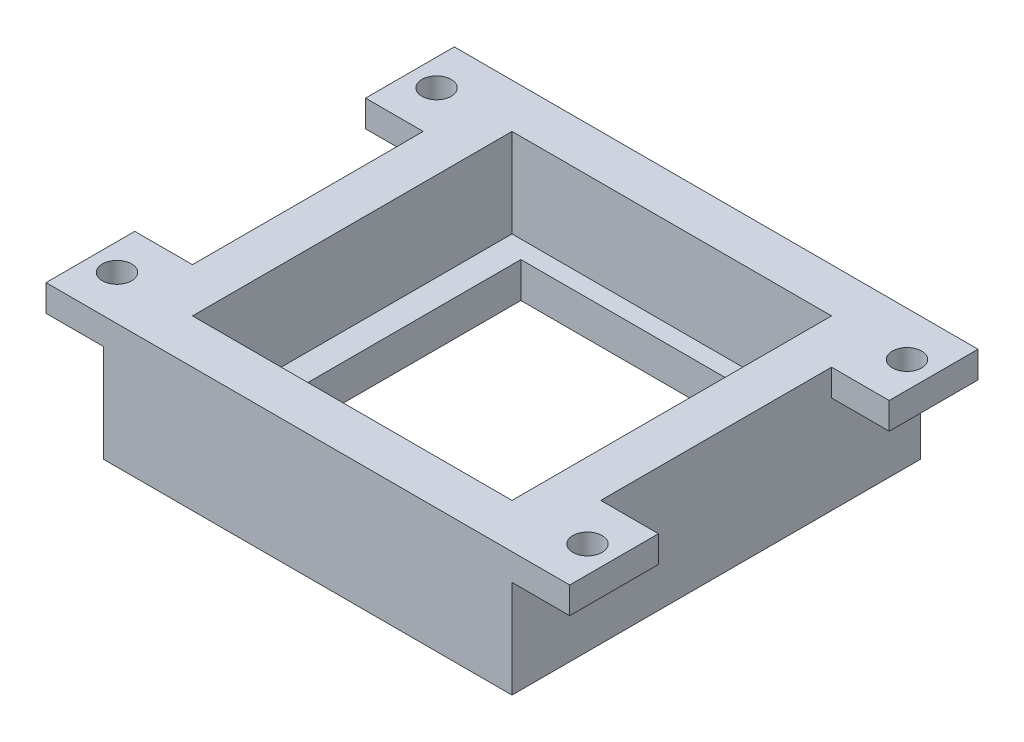
from build123d import *
from build123d.topology import SkipClean

# Parameters (mm, degrees)
SKETCH_1_W                 = 21
SKETCH_1_H                 = 20
EXTRUDE_1_DEPTH            = 4
SKETCH_2_R                 = 1.65
CUT_EXTRUDE_1_DEPTH        = 4
FILLET_1_R                 = 5
SKETCH_4_W                 = 44
SKETCH_4_H                 = 3
EXTRUDE_2_DEPTH            = 7
EXTRUDE_3_DEPTH            = 110
SKETCH_7_R                 = 1.5
CUT_EXTRUDE_3_DEPTH        = 93
CUT_EXTRUDE_4_DEPTH        = 93
SKETCH_18_W                = 8.046739473
SKETCH_18_H                = 3.477045647
CUT_EXTRUDE_5_DEPTH        = 10
EXTRUDE_START              = 1
SKETCH_21_R                = 1.5
EXTRUDE_4_DEPTH            = 1
SKETCH_27_W                = 38
SKETCH_27_H                = 4
EXTRUDE_9_DEPTH            = 1
FILLET_4_R                 = 0.5
EXTRUDE_START_2            = -4
SKETCH_28_R                = 1.5
EXTRUDE_10_DEPTH           = 4
SKETCH_30_W                = 6
SKETCH_30_H                = 110.5
EXTRUDE_11_DEPTH           = 4
SKETCH_31_W                = 50
SKETCH_31_H                = 4
CUT_EXTRUDE_6_DEPTH        = 5
SKETCH_32_W                = 30
SKETCH_32_H                = 31
CUT_EXTRUDE_7_DEPTH        = 15
SKETCH_33_W                = 23.953260528
SKETCH_33_H                = 6
EXTRUDE_12_DEPTH           = 4
SKETCH_34_W                = 46
SKETCH_34_H                = 46
SKETCH_34_W_2              = 36
SKETCH_34_H_2              = 36
EXTRUDE_1_2_DEPTH          = 10
SKETCH_36_W                = 6
SKETCH_36_H                = 6
EXTRUDE_13_DEPTH           = 4
SKETCH_37_R                = 1.7
CUT_EXTRUDE_8_DEPTH        = 10
FILLET_6_R                 = 1
SKETCH_38_W                = 10
SKETCH_38_H                = 5
CUT_EXTRUDE_9_DEPTH        = 10
SKETCH_39_W                = 7.314348503
SKETCH_39_H                = 1
SKETCH_39_W_2              = 6.638912025
EXTRUDE_14_DEPTH           = 4
SKETCH_40_W                = 10
SKETCH_40_H                = 1
SKETCH_40_H_2              = 4
EXTRUDE_15_DEPTH           = 14
SPLIT_START                = -29.5
SPLIT_BODIES_2_DEPTH       = 46
SPLIT_BODIES_2_2_DEPTH     = 5
SPLIT_START_2              = 11.5
SPLIT_BODIES_2_3_DEPTH     = 5
SPLIT_START_3              = -24.5
SPLIT_BODIES_2_4_OUTLINE_W = 4
SPLIT_BODIES_2_4_OUTLINE_H = 31
SPLIT_BODIES_2_4_DEPTH     = 3
SPLIT_START_4              = 8.5
SPLIT_BODIES_2_5_OUTLINE_W = 4
SPLIT_BODIES_2_5_OUTLINE_H = 31
SPLIT_BODIES_2_5_DEPTH     = 3
SPLIT_START_5              = -37.5
SPLIT_BODIES_2_6_OUTLINE_W = 14
SPLIT_BODIES_2_6_OUTLINE_H = 46
SPLIT_BODIES_2_6_DEPTH     = 54
SPLIT_START_6              = 10
SPLIT_BODIES_2_7_OUTLINE_R = 1.7
SPLIT_BODIES_2_7_DEPTH     = 4
SKETCH_43_W                = 5
SKETCH_43_H                = 5
SKETCH_43_W_2              = 36
EXTRUDE_16_DEPTH           = 3
SKETCH_44_W                = 6.5
SKETCH_44_H                = 10
SKETCH_44_R                = 1.65
EXTRUDE_17_DEPTH           = 3
SPLIT_START_7              = 24
SPLIT_BODIES_4_OUTLINE_W   = 59
SPLIT_BODIES_4_OUTLINE_H   = 10
SPLIT_BODIES_4_OUTLINE_R   = 1.65
SPLIT_BODIES_4_DEPTH       = 3
SPLIT_BODIES_4_2_OUTLINE_W = 59
SPLIT_BODIES_4_2_OUTLINE_H = 10
SPLIT_BODIES_4_2_OUTLINE_R = 1.65
SPLIT_BODIES_4_2_DEPTH     = 3
SPLIT_BODIES_4_3_OUTLINE_W = 59
SPLIT_BODIES_4_3_OUTLINE_H = 10
SPLIT_BODIES_4_3_OUTLINE_R = 1.65
SPLIT_BODIES_4_3_DEPTH     = 3


# Read off the part's stored shape, not the designer's step: 分割1, 分割2, 分割4
with BuildPart() as part:
    # 草图1 → Extrude 1 (new body)
    with BuildSketch(Plane.XY):
        Rectangle(SKETCH_1_W, SKETCH_1_H)
    extrude(amount=EXTRUDE_1_DEPTH)

    # 草图2 → 切除-拉伸1 (cut)
    with BuildSketch(Plane.XY.offset(4)):
        with Locations((-5, 4)):
            Circle(SKETCH_2_R)
        with Locations((5, 4)):
            Circle(SKETCH_2_R)
        with Locations((-5, -4)):
            Circle(SKETCH_2_R)
        with Locations((5, -4)):
            Circle(SKETCH_2_R)
    extrude(amount=-CUT_EXTRUDE_1_DEPTH, mode=Mode.SUBTRACT)

    # 圆角1
    fillet_1_edges = [part.edges().sort_by_distance(p)[0] for p in [
        (10.5, -10, 2),
        (-10.5, -10, 2),
    ]]
    fillet(fillet_1_edges, radius=FILLET_1_R)

    # 草图4 → 凸台-拉伸2 (add)
    with BuildSketch(Plane.XY.offset(4)):
        with Locations((-6.5, 11.5)):
            Rectangle(SKETCH_4_W, SKETCH_4_H)
    extrude(amount=-EXTRUDE_2_DEPTH)

    # 草图5 → 凸台-拉伸3 (add)
    with BuildSketch(Plane.XY.offset(4)):
        Polygon((-6.5, 13), (12.5, 13), (12.5, 10), (-25.5, 10), (-25.5, 13), align=None)
    extrude(amount=EXTRUDE_3_DEPTH)

    # 草图7 → 切除-拉伸3 (cut)
    with BuildSketch(Plane(origin=(0, 13, 0), x_dir=(1, 0, 0), z_dir=(0, 1, 0))):
        with Locations(Location((8.232, -104.79, 0), (0, 0, 270))):
            Circle(SKETCH_7_R)
        with Locations(Location((-21.232, -104.79, 0), (0, 0, 270))):
            Circle(SKETCH_7_R)
        with BuildLine():
            Line((5.476630264, -60.258900788), (5.476630264, -85.258900788))
            Line((5.476630264, -85.258900788), (5.476630264, -111))
            Line((5.476630264, -111), (-6.5, -111))
            Line((-6.5, -111), (-18.476630264, -111))
            Line((-18.476630264, -111), (-18.476630264, -85.258900788))
            Line((-18.476630264, -85.258900788), (-18.476630264, -60.258900788))
            ThreePointArc((-18.476630264, -60.258900788), (-6.5, -48.282270524), (5.476630264, -60.258900788))
        make_face()
    extrude(amount=-CUT_EXTRUDE_3_DEPTH, mode=Mode.SUBTRACT)

    # 草图12 → 切除-拉伸4 (cut)
    with BuildSketch(Plane(origin=(0, 13, 0), x_dir=(1, 0, 0), z_dir=(0, 1, 0))):
        with BuildLine():
            Line((-16.5, -11.5), (3.5, -11.5))
            ThreePointArc((3.5, -11.5), (6, -14), (3.5, -16.5))
            Line((3.5, -16.5), (-16.5, -16.5))
            ThreePointArc((-16.5, -16.5), (-19, -14), (-16.5, -11.5))
        make_face()
        with BuildLine():
            Line((-16.5, -24), (3.5, -24))
            ThreePointArc((3.5, -24), (6, -26.5), (3.5, -29))
            Line((3.5, -29), (-16.5, -29))
            ThreePointArc((-16.5, -29), (-19, -26.5), (-16.5, -24))
        make_face()
        with BuildLine():
            Line((-16.5, -34.5), (3.5, -34.5))
            ThreePointArc((3.5, -34.5), (6, -37), (3.5, -39.5))
            Line((3.5, -39.5), (-16.5, -39.5))
            ThreePointArc((-16.5, -39.5), (-19, -37), (-16.5, -34.5))
        make_face()
    extrude(amount=-CUT_EXTRUDE_4_DEPTH, mode=Mode.SUBTRACT)

    # 草图18 → 切除-拉伸5 (cut)
    with BuildSketch(Plane(origin=(0, 13, 0), x_dir=(1, 0, 0), z_dir=(0, 1, 0))):
        with Locations((5.476630263, -99.520878329)):
            Rectangle(SKETCH_18_W, SKETCH_18_H)
        with Locations((-18.476630263, -99.520878329)):
            Rectangle(SKETCH_18_W, SKETCH_18_H)
    extrude(amount=-CUT_EXTRUDE_5_DEPTH, mode=Mode.SUBTRACT)

    # 草图21 → 凸台-拉伸4 (add)
    with BuildSketch(Plane(origin=(0, 13, 0), x_dir=(1, 0, 0), z_dir=(0, 1, 0)).offset(EXTRUDE_START)):
        Polygon((12.5, -4), (15.5, -4), (15.5, 3), (-28.5, 3), (-28.5, -4), (-25.5, -4), (-25.5, -114), (12.5, -114), align=None)
        with Locations(Location((8.232, -104.79, 0), (0, 0, 270))):
            Circle(SKETCH_21_R, mode=Mode.SUBTRACT)
        with Locations(Location((-21.232, -104.79, 0), (0, 0, 270))):
            Circle(SKETCH_21_R, mode=Mode.SUBTRACT)
        with BuildLine():
            Line((9.5, -97.782355505), (5.476630264, -97.782355505))
            Line((5.476630264, -97.782355505), (5.476630264, -60.258900788))
            ThreePointArc((5.476630264, -60.258900788), (-6.5, -48.282270524), (-18.476630264, -60.258900788))
            Line((-18.476630264, -60.258900788), (-18.476630264, -97.782355505))
            Line((-18.476630264, -97.782355505), (-22.5, -97.782355505))
            Line((-22.5, -97.782355505), (-22.5, -101.259401152))
            Line((-22.5, -101.259401152), (-18.476630264, -101.259401152))
            Line((-18.476630264, -101.259401152), (-18.476630264, -111))
            Line((-18.476630264, -111), (5.476630264, -111))
            Line((5.476630264, -111), (5.476630264, -101.259401152))
            Line((5.476630264, -101.259401152), (9.5, -101.259401152))
            Line((9.5, -101.259401152), (9.5, -97.782355505))
        make_face(mode=Mode.SUBTRACT)
        with BuildLine():
            Line((-16.5, -39.5), (3.5, -39.5))
            ThreePointArc((3.5, -39.5), (6, -37), (3.5, -34.5))
            Line((3.5, -34.5), (-16.5, -34.5))
            ThreePointArc((-16.5, -34.5), (-19, -37), (-16.5, -39.5))
        make_face(mode=Mode.SUBTRACT)
        with BuildLine():
            Line((-16.5, -29), (3.5, -29))
            ThreePointArc((3.5, -29), (6, -26.5), (3.5, -24))
            Line((3.5, -24), (-16.5, -24))
            ThreePointArc((-16.5, -24), (-19, -26.5), (-16.5, -29))
        make_face(mode=Mode.SUBTRACT)
        with BuildLine():
            Line((-16.5, -16.5), (3.5, -16.5))
            ThreePointArc((3.5, -16.5), (6, -14), (3.5, -11.5))
            Line((3.5, -11.5), (-16.5, -11.5))
            ThreePointArc((-16.5, -11.5), (-19, -14), (-16.5, -16.5))
        make_face(mode=Mode.SUBTRACT)
    extrude(amount=-EXTRUDE_4_DEPTH)

    # 草图27 → 凸台-拉伸9 (add)
    with BuildSketch(Plane.XY.offset(114)):
        with Locations((-6.5, 12)):
            Rectangle(SKETCH_27_W, SKETCH_27_H)
    extrude(amount=EXTRUDE_9_DEPTH)

    # 圆角4
    fillet_4_edges = [part.edges().sort_by_distance(p)[0] for p in [
        (-25.5, 12, 115),
        (12.5, 12, 115),
    ]]
    fillet(fillet_4_edges, radius=FILLET_4_R)

    # 草图28 → 凸台-拉伸10 (add)
    with BuildSketch(Plane.XZ.offset(-10).offset(EXTRUDE_START_2)):
        with Locations((-21.232, 104.79)):
            Circle(SKETCH_28_R)
        with Locations((8.232, 104.79)):
            Circle(SKETCH_28_R)
        Polygon((-18.476630264, 111), (5.476630264, 111), (5.476630264, 101.259401152), (9.5, 101.259401152), (9.5, 97.782355505), (5.476630264, 97.782355505), (5.476630264, 75), (-18.476630264, 75), (-18.476630264, 97.782355505), (-22.5, 97.782355505), (-22.5, 101.259401152), (-18.476630264, 101.259401152), align=None)
    extrude(amount=EXTRUDE_10_DEPTH)

    # 草图30 → 凸台-拉伸11 (add)
    with BuildSketch(Plane(origin=(0, 14, 0), x_dir=(1, 0, 0), z_dir=(0, 1, 0))):
        with Locations((-28.5, -59.25)):
            Rectangle(SKETCH_30_W, SKETCH_30_H)
        with Locations((15.5, -59.25)):
            Rectangle(SKETCH_30_W, SKETCH_30_H)
    extrude(amount=-EXTRUDE_11_DEPTH)

    # 草图31 → 切除-拉伸6 (cut)
    with BuildSketch(Plane.XY.offset(115)):
        with Locations((-6.5, 12)):
            Rectangle(SKETCH_31_W, SKETCH_31_H)
    extrude(amount=-CUT_EXTRUDE_6_DEPTH, mode=Mode.SUBTRACT)

    # 草图32 → 切除-拉伸7 (cut)
    with BuildSketch(Plane(origin=(0, 14, 0), x_dir=(1, 0, 0), z_dir=(0, 1, 0))):
        with Locations((-6.5, -86.5)):
            Rectangle(SKETCH_32_W, SKETCH_32_H)
    extrude(amount=-CUT_EXTRUDE_7_DEPTH, mode=Mode.SUBTRACT)

    # 草图33 → 凸台-拉伸12 (add)
    with BuildSketch(Plane(origin=(0, 14, 0), x_dir=(1, 0, 0), z_dir=(0, 1, 0))):
        with Locations((-6.5, -68)):
            Rectangle(SKETCH_33_W, SKETCH_33_H)
    extrude(amount=-EXTRUDE_12_DEPTH)

    # 草图34 → Extrude 1 2 (add)
    with BuildSketch(Plane(origin=(0, 14, 0), x_dir=(1, 0, 0), z_dir=(0, 1, 0))):
        with Locations((-6.5, -87)):
            Rectangle(SKETCH_34_W, SKETCH_34_H)
        with Locations((-6.5, -87)):
            Rectangle(SKETCH_34_W_2, SKETCH_34_H_2, mode=Mode.SUBTRACT)
    extrude(amount=EXTRUDE_1_2_DEPTH)

    # 草图36 → 凸台-拉伸13 (add)
    with BuildSketch(Plane(origin=(0, 14, 0), x_dir=(1, 0, 0), z_dir=(0, 1, 0))):
        with Locations((21.5, -76)):
            Rectangle(SKETCH_36_W, SKETCH_36_H)
        with Locations((21.5, -97)):
            Rectangle(SKETCH_36_W, SKETCH_36_H)
        with Locations((-34.5, -97)):
            Rectangle(SKETCH_36_W, SKETCH_36_H)
        with Locations((-34.5, -76)):
            Rectangle(SKETCH_36_W, SKETCH_36_H)
    extrude(amount=-EXTRUDE_13_DEPTH)

    # 草图37 → 切除-拉伸8 (cut)
    with BuildSketch(Plane(origin=(0, 14, 0), x_dir=(1, 0, 0), z_dir=(0, 1, 0))):
        with Locations(Location((21.5, -76, 0), (0, 0, 270))):
            Circle(SKETCH_37_R)
        with Locations(Location((21.5, -97, 0), (0, 0, 270))):
            Circle(SKETCH_37_R)
        with Locations(Location((-34.5, -76, 0), (0, 0, 270))):
            Circle(SKETCH_37_R)
        with Locations(Location((-34.5, -97, 0), (0, 0, 270))):
            Circle(SKETCH_37_R)
    extrude(amount=-CUT_EXTRUDE_8_DEPTH, mode=Mode.SUBTRACT)

    # 圆角6
    fillet_6_edges = [part.edges().sort_by_distance(p)[0] for p in [
        (24.5, 12, 79),
        (24.5, 12, 73),
        (24.5, 12, 100),
        (24.5, 12, 94),
        (-37.5, 12, 100),
        (-37.5, 12, 94),
        (-37.5, 12, 79),
        (-37.5, 12, 73),
    ]]
    fillet(fillet_6_edges, radius=FILLET_6_R)

    # 草图38 → 切除-拉伸9 (cut)
    with BuildSketch(Plane(origin=(0, 24, 0), x_dir=(1, 0, 0), z_dir=(0, 1, 0))):
        with Locations((-6.162281761, -66.5)):
            Rectangle(SKETCH_38_W, SKETCH_38_H)
    extrude(amount=-CUT_EXTRUDE_9_DEPTH, mode=Mode.SUBTRACT)


with BuildPart() as body_2:
    # Split Bodies 1: the piece on the far side of the plane
    add(part.part)
    split(bisect_by=Plane.XY.offset(64), keep=Keep.BOTTOM)


with BuildPart() as part_1:
    add(part.part)

    # Split Bodies 1
    split(bisect_by=Plane.XY.offset(64), keep=Keep.TOP)

    # 草图39 → 凸台-拉伸14 (add)
    with BuildSketch(Plane.XZ.offset(-14)):
        with Locations((-14.819456013, 64.5)):
            Rectangle(SKETCH_39_W, SKETCH_39_H)
        with Locations((2.157174252, 64.5)):
            Rectangle(SKETCH_39_W_2, SKETCH_39_H)
    extrude(amount=EXTRUDE_14_DEPTH)

    # 草图40 → 凸台-拉伸15 (add)
    with BuildSketch(Plane.XZ.offset(-10)):
        with Locations((-6.162281761, 64.5)):
            Rectangle(SKETCH_40_W, SKETCH_40_H)
        with Locations((-6.162281761, 67)):
            Rectangle(SKETCH_40_W, SKETCH_40_H_2)
    extrude(amount=-EXTRUDE_15_DEPTH)

    # Split Bodies 2 6 outline → Split Bodies 2 6 (cut)
    with BuildSketch(Plane.YZ.offset(SPLIT_START_5)):
        with Locations((17, 87)):
            Rectangle(SPLIT_BODIES_2_6_OUTLINE_W, SPLIT_BODIES_2_6_OUTLINE_H)
    extrude(amount=SPLIT_BODIES_2_6_DEPTH, mode=Mode.SUBTRACT)


with BuildPart() as body_2_2:
    # Split Bodies 2 outline → Split Bodies 2 (new body)
    with BuildSketch(Plane.YZ.offset(SPLIT_START)):
        Polygon((24, 69), (14, 69), (14, 71), (10, 71), (10, 64), (24, 64), align=None)
        Polygon((10, 102), (14, 102), (14, 105), (24, 105), (24, 110), (10, 110), align=None)
    extrude(amount=SPLIT_BODIES_2_DEPTH)

    # Split Bodies 2 2 outline → Split Bodies 2 2 (add)
    with BuildSketch(Plane.YZ.offset(SPLIT_START)):
        Polygon((14, 71), (14, 69), (24, 69), (24, 105), (14, 105), (14, 102), (10, 102), (10, 71), align=None)
    extrude(amount=SPLIT_BODIES_2_2_DEPTH)

    # Split Bodies 2 3 outline → Split Bodies 2 3 (add)
    with BuildSketch(Plane.YZ.offset(SPLIT_START_2)):
        Polygon((14, 71), (14, 69), (24, 69), (24, 105), (14, 105), (14, 102), (10, 102), (10, 71), align=None)
    extrude(amount=SPLIT_BODIES_2_3_DEPTH)

    # Split Bodies 2 4 outline → Split Bodies 2 4 (add)
    with BuildSketch(Plane.YZ.offset(SPLIT_START_3)):
        with Locations((12, 86.5)):
            Rectangle(SPLIT_BODIES_2_4_OUTLINE_W, SPLIT_BODIES_2_4_OUTLINE_H)
    extrude(amount=SPLIT_BODIES_2_4_DEPTH)

    # Split Bodies 2 5 outline → Split Bodies 2 5 (add)
    with BuildSketch(Plane.YZ.offset(SPLIT_START_4)):
        with Locations((12, 86.5)):
            Rectangle(SPLIT_BODIES_2_5_OUTLINE_W, SPLIT_BODIES_2_5_OUTLINE_H)
    extrude(amount=SPLIT_BODIES_2_5_DEPTH)

    # 草图43 → 凸台-拉伸16 (add)
    with BuildSketch(Plane(origin=(0, 24, 0), x_dir=(1, 0, 0), z_dir=(0, 1, 0))):
        with BuildLine():
            Line((-36, -100), (-36, -105))
            Line((-36, -105), (-34.65, -105))
            ThreePointArc((-34.65, -105), (-33, -103.35), (-31.35, -105))
            Line((-31.35, -105), (-29.5, -105))
            Line((-29.5, -105), (-29.5, -100))
            Line((-29.5, -100), (-36, -100))
        make_face()
        with BuildLine():
            Line((-36, -105), (-36, -110))
            Line((-36, -110), (-29.5, -110))
            Line((-29.5, -110), (-29.5, -105))
            Line((-29.5, -105), (-31.35, -105))
            ThreePointArc((-31.35, -105), (-33, -106.65), (-34.65, -105))
            Line((-34.65, -105), (-36, -105))
        make_face()
        Polygon((-29.5, -105), (-29.5, -110), (16.5, -110), (16.5, -105), (11.5, -105), (-24.5, -105), align=None)
        with Locations((-27, -102.5)):
            Rectangle(SKETCH_43_W, SKETCH_43_H)
        with Locations((-6.5, -102.5)):
            Rectangle(SKETCH_43_W_2, SKETCH_43_H)
        with Locations((14, -102.5)):
            Rectangle(SKETCH_43_W, SKETCH_43_H)
        with BuildLine():
            Line((16.5, -105), (16.5, -110))
            Line((16.5, -110), (23, -110))
            Line((23, -110), (23, -105))
            Line((23, -105), (21.65, -105))
            ThreePointArc((21.65, -105), (20, -106.65), (18.35, -105))
            Line((18.35, -105), (16.5, -105))
        make_face()
        with BuildLine():
            Line((16.5, -100), (16.5, -105))
            Line((16.5, -105), (18.35, -105))
            ThreePointArc((18.35, -105), (20, -103.35), (21.65, -105))
            Line((21.65, -105), (23, -105))
            Line((23, -105), (23, -100))
            Line((23, -100), (16.5, -100))
        make_face()
    extrude_16 = extrude(amount=EXTRUDE_16_DEPTH)

    # 草图44 → 凸台-拉伸17 (add)
    # profile 1 of 2: a face of its own
    with SkipClean():  # the faces are left unmerged after this step: merging them gives an invalid solid
        with BuildSketch(Plane.XZ.offset(-24)):
            with Locations((-32.75, 105)):
                Rectangle(SKETCH_44_W, SKETCH_44_H)
            with Locations(Location((-33, 105, 0), (0, 0, 270))):
                Circle(SKETCH_44_R, mode=Mode.SUBTRACT)
        # profile 2 of 2: a face of its own
        with BuildSketch(Plane.XZ.offset(-24)):
            with Locations((19.75, 105)):
                Rectangle(SKETCH_44_W, SKETCH_44_H)
            with Locations(Location((20, 105, 0), (0, 0, 270))):
                Circle(SKETCH_44_R, mode=Mode.SUBTRACT)
        extrude_17 = extrude(amount=EXTRUDE_17_DEPTH)

    # 镜向2: 凸台-拉伸16, 凸台-拉伸17 across plane
    with SkipClean():  # the faces are left unmerged after this step: merging them gives an invalid solid
        add(extrude_16.mirror(Plane(origin=(0, 0, 87), x_dir=(1, 0, 0), z_dir=(0, 0, -1))))
        add(extrude_17.mirror(Plane(origin=(0, 0, 87), x_dir=(1, 0, 0), z_dir=(0, 0, -1))))
    add(body_2_2.part.scale(1), mode=Mode.REPLACE)  # the faces are merged on a copy

    # Split Bodies 4 outline → Split Bodies 4 (cut)
    # profile 1 of 2: a face of its own
    with BuildSketch(Plane(origin=(0, 0, 0), x_dir=(1, 0, 0), z_dir=(0, 1, 0)).offset(SPLIT_START_7)):
        with Locations((-6.5, -69)):
            Rectangle(SPLIT_BODIES_4_OUTLINE_W, SPLIT_BODIES_4_OUTLINE_H)
        with Locations((-33, -69)):
            Circle(SPLIT_BODIES_4_OUTLINE_R, mode=Mode.SUBTRACT)
        with Locations((20, -69)):
            Circle(SPLIT_BODIES_4_OUTLINE_R, mode=Mode.SUBTRACT)
    # profile 2 of 2: a face of its own
    with BuildSketch(Plane(origin=(0, 0, 0), x_dir=(1, 0, 0), z_dir=(0, 1, 0)).offset(SPLIT_START_7)):
        with Locations((-6.5, -105)):
            Rectangle(SPLIT_BODIES_4_OUTLINE_W, SPLIT_BODIES_4_OUTLINE_H)
        with Locations((-33, -105)):
            Circle(SPLIT_BODIES_4_OUTLINE_R, mode=Mode.SUBTRACT)
        with Locations((20, -105)):
            Circle(SPLIT_BODIES_4_OUTLINE_R, mode=Mode.SUBTRACT)
    extrude(amount=SPLIT_BODIES_4_DEPTH, mode=Mode.SUBTRACT)


with BuildPart() as body_3:
    # Split Bodies 2 7 outline → Split Bodies 2 7 (new body)
    with BuildSketch(Plane(origin=(0, 0, 0), x_dir=(1, 0, 0), z_dir=(0, 1, 0)).offset(SPLIT_START_6)):
        with BuildLine():
            Line((-29.5, -110), (-29.5, -64))
            Line((-29.5, -64), (-31.5, -64))
            Line((-31.5, -64), (-31.5, -73))
            Line((-31.5, -73), (-36.5, -73))
            ThreePointArc((-36.5, -73), (-37.207106781, -73.292893219), (-37.5, -74))
            Line((-37.5, -74), (-37.5, -78))
            ThreePointArc((-37.5, -78), (-37.207106781, -78.707106781), (-36.5, -79))
            Line((-36.5, -79), (-31.5, -79))
            Line((-31.5, -79), (-31.5, -94))
            Line((-31.5, -94), (-36.5, -94))
            ThreePointArc((-36.5, -94), (-37.207106781, -94.292893219), (-37.5, -95))
            Line((-37.5, -95), (-37.5, -99))
            ThreePointArc((-37.5, -99), (-37.207106781, -99.707106781), (-36.5, -100))
            Line((-36.5, -100), (-31.5, -100))
            Line((-31.5, -100), (-31.5, -110))
            Line((-31.5, -110), (-29.5, -110))
        make_face()
        with Locations((-34.5, -97)):
            Circle(SPLIT_BODIES_2_7_OUTLINE_R, mode=Mode.SUBTRACT)
        with Locations((-34.5, -76)):
            Circle(SPLIT_BODIES_2_7_OUTLINE_R, mode=Mode.SUBTRACT)
    extrude(amount=SPLIT_BODIES_2_7_DEPTH)


with BuildPart() as body_2_3:
    # Split Bodies 4 2 outline → Split Bodies 4 2 (new body)
    with BuildSketch(Plane(origin=(0, 0, 0), x_dir=(1, 0, 0), z_dir=(0, 1, 0)).offset(SPLIT_START_7)):
        with Locations((-6.5, -105)):
            Rectangle(SPLIT_BODIES_4_2_OUTLINE_W, SPLIT_BODIES_4_2_OUTLINE_H)
        with Locations((-33, -105)):
            Circle(SPLIT_BODIES_4_2_OUTLINE_R, mode=Mode.SUBTRACT)
        with Locations((20, -105)):
            Circle(SPLIT_BODIES_4_2_OUTLINE_R, mode=Mode.SUBTRACT)
    extrude(amount=SPLIT_BODIES_4_2_DEPTH)


with BuildPart() as body_3_2:
    # Split Bodies 4 3 outline → Split Bodies 4 3 (new body)
    with BuildSketch(Plane(origin=(0, 0, 0), x_dir=(1, 0, 0), z_dir=(0, 1, 0)).offset(SPLIT_START_7)):
        with Locations((-6.5, -69)):
            Rectangle(SPLIT_BODIES_4_3_OUTLINE_W, SPLIT_BODIES_4_3_OUTLINE_H)
        with Locations((-33, -69)):
            Circle(SPLIT_BODIES_4_3_OUTLINE_R, mode=Mode.SUBTRACT)
        with Locations((20, -69)):
            Circle(SPLIT_BODIES_4_3_OUTLINE_R, mode=Mode.SUBTRACT)
    extrude(amount=SPLIT_BODIES_4_3_DEPTH)


solid = body_2_2.part
